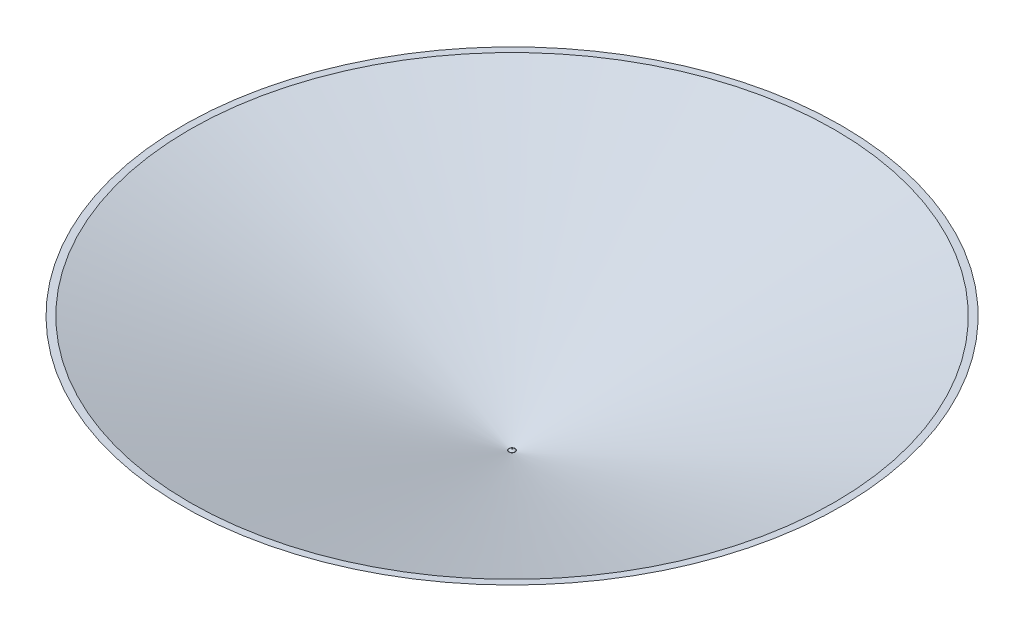
from build123d import *

# Parameters (mm, degrees)
SKETCH1_R           = 2.4
SKETCH1_W           = 8.2
SKETCH1_H           = 3.2
SKETCH1_R_2         = 1.25
BOSS_EXTRUDE1_DEPTH = 1.5
SKETCH1_3_R         = 2
SKETCH1_3_W         = 8.2
SKETCH1_3_H         = 3.2
BOSS_EXTRUDE2_DEPTH = 4.5
SKETCH1_4_R         = 2
BOSS_EXTRUDE3_DEPTH = 5
SKETCH1_5_R         = 2
BOSS_EXTRUDE4_DEPTH = 4
CUT_EXTRUDE1_START  = 1
SKETCH1_6_R         = 2.4
SKETCH1_6_R_2       = 1.25
CUT_EXTRUDE1_DEPTH  = 4
CHAMFER1_SIZE       = 1
FILLET1_R           = 0.5
FILLET2_R           = 1
SKETCH2_W           = 22
SKETCH2_H           = 1
SKETCH2_W_2         = 20
SKETCH2_H_2         = 3.5
BOSS_EXTRUDE5_DEPTH = 2.5
SHELL1_T            = -1


# Read off the part's stored shape, not the designer's step: Boss-Extrude6
with BuildPart() as part:
    # Sketch1 → Boss-Extrude1 (new body)
    # profile 1 of 5: a face of its own
    with BuildSketch(Plane(origin=(0, 0, 0), x_dir=(1, 0, 0), z_dir=(0, 1, 0))):
        with BuildLine():
            ThreePointArc((-19, 16), (-18.121320344, 18.121320344), (-16, 19))
            Line((-16, 19), (16, 19))
            ThreePointArc((16, 19), (18.121320344, 18.121320344), (19, 16))
            Line((19, 16), (19, -16))
            ThreePointArc((19, -16), (18.121320344, -18.121320344), (16, -19))
            Line((16, -19), (-16, -19))
            ThreePointArc((-16, -19), (-18.121320344, -18.121320344), (-19, -16))
            Line((-19, -16), (-19, 16))
        make_face()
        with Locations((15, -15)):
            Circle(SKETCH1_R, mode=Mode.SUBTRACT)
        with Locations((15, 15)):
            Circle(SKETCH1_R, mode=Mode.SUBTRACT)
        with Locations((-15, 15)):
            Circle(SKETCH1_R, mode=Mode.SUBTRACT)
        with Locations((-15, -15)):
            Circle(SKETCH1_R, mode=Mode.SUBTRACT)
        with Locations((-2.6, 9.2)):
            Rectangle(SKETCH1_W, SKETCH1_H, mode=Mode.SUBTRACT)
        with BuildLine():
            Line((-9, 1.6), (-9, 5.45))
            ThreePointArc((-9, 5.45), (-8.765685425, 6.015685425), (-8.2, 6.25))
            Line((-8.2, 6.25), (8.2, 6.25))
            ThreePointArc((8.2, 6.25), (8.765685425, 6.015685425), (9, 5.45))
            Line((9, 5.45), (9, 1.6))
            ThreePointArc((9, 1.6), (12.2, 0), (9, -1.6))
            Line((9, -1.6), (9, -5.45))
            ThreePointArc((9, -5.45), (8.765685425, -6.015685425), (8.2, -6.25))
            Line((8.2, -6.25), (-8.2, -6.25))
            ThreePointArc((-8.2, -6.25), (-8.765685425, -6.015685425), (-9, -5.45))
            Line((-9, -5.45), (-9, -1.6))
            ThreePointArc((-9, -1.6), (-12.2, 0), (-9, 1.6))
        make_face(mode=Mode.SUBTRACT)
    # profile 2 of 5: a face of its own
    with BuildSketch(Plane(origin=(0, 0, 0), x_dir=(1, 0, 0), z_dir=(0, 1, 0))):
        with Locations((15, 15)):
            Circle(SKETCH1_R)
        with Locations(Location((15, 15, 0), (0, 0, 270))):
            Circle(SKETCH1_R_2, mode=Mode.SUBTRACT)
    # profile 3 of 5: a face of its own
    with BuildSketch(Plane(origin=(0, 0, 0), x_dir=(1, 0, 0), z_dir=(0, 1, 0))):
        with Locations((-15, 15)):
            Circle(SKETCH1_R)
        with Locations(Location((-15, 15, 0), (0, 0, 270))):
            Circle(SKETCH1_R_2, mode=Mode.SUBTRACT)
    # profile 4 of 5: a face of its own
    with BuildSketch(Plane(origin=(0, 0, 0), x_dir=(1, 0, 0), z_dir=(0, 1, 0))):
        with Locations((-15, -15)):
            Circle(SKETCH1_R)
        with Locations(Location((-15, -15, 0), (0, 0, 270))):
            Circle(SKETCH1_R_2, mode=Mode.SUBTRACT)
    # profile 5 of 5: a face of its own
    with BuildSketch(Plane(origin=(0, 0, 0), x_dir=(1, 0, 0), z_dir=(0, 1, 0))):
        with Locations((15, -15)):
            Circle(SKETCH1_R)
        with Locations(Location((15, -15, 0), (0, 0, 270))):
            Circle(SKETCH1_R_2, mode=Mode.SUBTRACT)
    extrude(amount=BOSS_EXTRUDE1_DEPTH)

    # Sketch1<3> → Boss-Extrude2 (add)
    # profile 1 of 2: a face of its own
    with BuildSketch(Plane(origin=(0, 0, 0), x_dir=(1, 0, 0), z_dir=(0, 1, 0))):
        with BuildLine():
            ThreePointArc((-9, 5.45), (-8.765685425, 6.015685425), (-8.2, 6.25))
            Line((-8.2, 6.25), (8.2, 6.25))
            ThreePointArc((8.2, 6.25), (8.765685425, 6.015685425), (9, 5.45))
            Line((9, 5.45), (9, 1.6))
            ThreePointArc((9, 1.6), (12.2, 0), (9, -1.6))
            Line((9, -1.6), (9, -5.45))
            ThreePointArc((9, -5.45), (8.765685425, -6.015685425), (8.2, -6.25))
            Line((8.2, -6.25), (-8.2, -6.25))
            ThreePointArc((-8.2, -6.25), (-8.765685425, -6.015685425), (-9, -5.45))
            Line((-9, -5.45), (-9, -1.6))
            ThreePointArc((-9, -1.6), (-12.2, 0), (-9, 1.6))
            Line((-9, 1.6), (-9, 5.45))
        make_face()
        with Locations(Location((0, 0, 0), (0, 0, 270))):
            Circle(SKETCH1_3_R, mode=Mode.SUBTRACT)
        with BuildLine():
            ThreePointArc((-6.7, 2), (-7.053553391, 1.853553391), (-7.2, 1.5))
            Line((-7.2, 1.5), (-7.2, -1.5))
            ThreePointArc((-7.2, -1.5), (-7.053553391, -1.853553391), (-6.7, -2))
            Line((-6.7, -2), (-3.7, -2))
            ThreePointArc((-3.7, -2), (-3.346446609, -1.853553391), (-3.2, -1.5))
            Line((-3.2, -1.5), (-3.2, 1.5))
            ThreePointArc((-3.2, 1.5), (-3.346446609, 1.853553391), (-3.7, 2))
            Line((-3.7, 2), (-6.7, 2))
        make_face(mode=Mode.SUBTRACT)
    # profile 2 of 2: a face of its own
    with BuildSketch(Plane(origin=(0, 0, 0), x_dir=(1, 0, 0), z_dir=(0, 1, 0))):
        with Locations((-2.6, 9.2)):
            Rectangle(SKETCH1_3_W, SKETCH1_3_H)
    extrude(amount=BOSS_EXTRUDE2_DEPTH)

    # Sketch1<4> → Boss-Extrude3 (add)
    with BuildSketch(Plane(origin=(0, 0, 0), x_dir=(1, 0, 0), z_dir=(0, 1, 0))):
        with BuildLine():
            ThreePointArc((-9, 5.45), (-8.765685425, 6.015685425), (-8.2, 6.25))
            Line((-8.2, 6.25), (8.2, 6.25))
            ThreePointArc((8.2, 6.25), (8.765685425, 6.015685425), (9, 5.45))
            Line((9, 5.45), (9, 1.6))
            ThreePointArc((9, 1.6), (12.2, 0), (9, -1.6))
            Line((9, -1.6), (9, -5.45))
            ThreePointArc((9, -5.45), (8.765685425, -6.015685425), (8.2, -6.25))
            Line((8.2, -6.25), (-8.2, -6.25))
            ThreePointArc((-8.2, -6.25), (-8.765685425, -6.015685425), (-9, -5.45))
            Line((-9, -5.45), (-9, -1.6))
            ThreePointArc((-9, -1.6), (-12.2, 0), (-9, 1.6))
            Line((-9, 1.6), (-9, 5.45))
        make_face()
        with Locations(Location((0, 0, 0), (0, 0, 270))):
            Circle(SKETCH1_4_R, mode=Mode.SUBTRACT)
        with BuildLine():
            ThreePointArc((-6.7, 2), (-7.053553391, 1.853553391), (-7.2, 1.5))
            Line((-7.2, 1.5), (-7.2, -1.5))
            ThreePointArc((-7.2, -1.5), (-7.053553391, -1.853553391), (-6.7, -2))
            Line((-6.7, -2), (-3.7, -2))
            ThreePointArc((-3.7, -2), (-3.346446609, -1.853553391), (-3.2, -1.5))
            Line((-3.2, -1.5), (-3.2, 1.5))
            ThreePointArc((-3.2, 1.5), (-3.346446609, 1.853553391), (-3.7, 2))
            Line((-3.7, 2), (-6.7, 2))
        make_face(mode=Mode.SUBTRACT)
    extrude(amount=BOSS_EXTRUDE3_DEPTH)

    # Sketch1<5> → Boss-Extrude4 (add)
    with BuildSketch(Plane(origin=(0, 0, 0), x_dir=(1, 0, 0), z_dir=(0, 1, 0))):
        with BuildLine():
            Line((-6.7, 2), (-3.7, 2))
            ThreePointArc((-3.7, 2), (-3.346446609, 1.853553391), (-3.2, 1.5))
            Line((-3.2, 1.5), (-3.2, -1.5))
            ThreePointArc((-3.2, -1.5), (-3.346446609, -1.853553391), (-3.7, -2))
            Line((-3.7, -2), (-6.7, -2))
            ThreePointArc((-6.7, -2), (-7.053553391, -1.853553391), (-7.2, -1.5))
            Line((-7.2, -1.5), (-7.2, 1.5))
            ThreePointArc((-7.2, 1.5), (-7.053553391, 1.853553391), (-6.7, 2))
        make_face()
        with Locations(Location((0, 0, 0), (0, 0, 270))):
            Circle(SKETCH1_5_R)
    extrude(amount=BOSS_EXTRUDE4_DEPTH)

    # Sketch1<6> → Cut-Extrude1 (cut)
    # profile 1 of 4: a face of its own
    with BuildSketch(Plane(origin=(0, 0, 0), x_dir=(1, 0, 0), z_dir=(0, 1, 0)).offset(CUT_EXTRUDE1_START)):
        with Locations(Location((-15, 15, 0), (0, 0, 270))):
            Circle(SKETCH1_6_R)
        with Locations(Location((-15, 15, 0), (0, 0, 270))):
            Circle(SKETCH1_6_R_2, mode=Mode.SUBTRACT)
    # profile 2 of 4: a face of its own
    with BuildSketch(Plane(origin=(0, 0, 0), x_dir=(1, 0, 0), z_dir=(0, 1, 0)).offset(CUT_EXTRUDE1_START)):
        with Locations(Location((-15, -15, 0), (0, 0, 270))):
            Circle(SKETCH1_6_R)
        with Locations(Location((-15, -15, 0), (0, 0, 270))):
            Circle(SKETCH1_6_R_2, mode=Mode.SUBTRACT)
    # profile 3 of 4: a face of its own
    with BuildSketch(Plane(origin=(0, 0, 0), x_dir=(1, 0, 0), z_dir=(0, 1, 0)).offset(CUT_EXTRUDE1_START)):
        with Locations(Location((15, -15, 0), (0, 0, 270))):
            Circle(SKETCH1_6_R)
        with Locations(Location((15, -15, 0), (0, 0, 270))):
            Circle(SKETCH1_6_R_2, mode=Mode.SUBTRACT)
    # profile 4 of 4: a face of its own
    with BuildSketch(Plane(origin=(0, 0, 0), x_dir=(1, 0, 0), z_dir=(0, 1, 0)).offset(CUT_EXTRUDE1_START)):
        with Locations(Location((15, 15, 0), (0, 0, 270))):
            Circle(SKETCH1_6_R)
        with Locations(Location((15, 15, 0), (0, 0, 270))):
            Circle(SKETCH1_6_R_2, mode=Mode.SUBTRACT)
    extrude(amount=CUT_EXTRUDE1_DEPTH, mode=Mode.SUBTRACT)

    # Chamfer1
    chamfer1_edges = [part.edges().sort_by_distance(p)[0] for p in [
        (0, 4, -2),
    ]]
    chamfer(chamfer1_edges, length=CHAMFER1_SIZE - 0.0001)  # a hair under: the kernel refuses the full size

    # Fillet1
    fillet1_edges = [part.edges().sort_by_distance(p)[0] for p in [
        (-7.053553391, 5, -1.853553391),
        (-3.346446609, 5, 1.853553391),
        (-5.2, 5, 2),
        (-7.053553391, 5, 1.853553391),
        (-7.2, 5, 0),
        (-5.2, 5, -2),
        (-3.346446609, 5, -1.853553391),
        (-3.2, 5, 0),
    ]]
    fillet(fillet1_edges, radius=FILLET1_R)

    # Fillet2
    fillet2_edges = [part.edges().sort_by_distance(p)[0] for p in [
        (-9, 3.25, -1.6),
        (-9, 3.25, 1.6),
        (9, 3.25, 1.6),
        (9, 3.25, -1.6),
    ]]
    fillet(fillet2_edges, radius=FILLET2_R)

    # Sketch2 → Boss-Extrude5 (add)
    with BuildSketch(Plane.XZ):
        with Locations((0, 18.3)):
            Rectangle(SKETCH2_W, SKETCH2_H)
        with Locations((0, 16.05)):
            Rectangle(SKETCH2_W_2, SKETCH2_H_2)
    extrude(amount=BOSS_EXTRUDE5_DEPTH)


with BuildPart() as body_2:
    # Boss-Extrude6 outline → Boss-Extrude6 (revolve)
    with BuildSketch(Plane.XY):
        Polygon((1, 5), (1.5, 5), (138.873870973, 55), (0, 55), (0, 5.363970234), align=None)
    revolve(axis=Axis((0, 0, 0), (0, 1, 0)))

    # Shell1
    shell1_openings = [body_2.faces().sort_by_distance(p)[0] for p in [
        (0, 55, 0),
    ]]
    offset(amount=SHELL1_T, openings=shell1_openings, kind=Kind.INTERSECTION)


solid = Compound([part.part, body_2.part])
